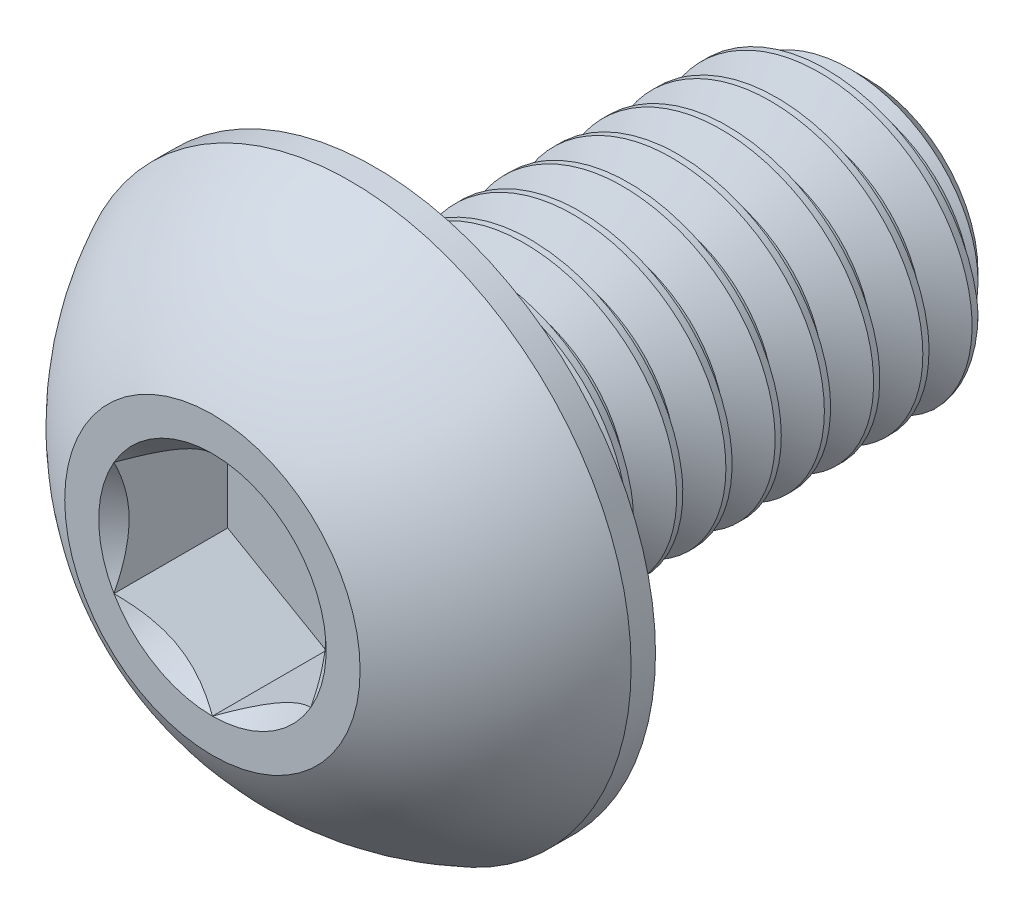
from build123d import *

# Parameters (mm, degrees)
SKETCH1_W          = 5
SKETCH1_H          = 1.5
CHAMFER1_SIZE      = 0.375
CUT_SWEEP1_PITCH   = 0.5
CUT_EXTRUDE2_DEPTH = 1.155


with BuildPart() as part:
    # Sketch1 → Revolve1 (revolve)
    with BuildSketch(Plane(origin=(0, 0, 0), x_dir=(0, 0, -1), z_dir=(1, 0, 0))):
        with Locations((4.15, 0.75)):
            Rectangle(SKETCH1_W, SKETCH1_H)
    revolve(axis=Axis((0, 0, -6.65), (0, 0, 1)))

    # Chamfer1
    chamfer1_edges = [part.edges().sort_by_distance(p)[0] for p in [
        (0, -1.5, -6.65),
    ]]
    chamfer(chamfer1_edges, length=CHAMFER1_SIZE)

    # Cut-Sweep1: the profile of Sketch2 profile screwed along a right-hand helix of 11 turns, 6 arcs to a turn; built about Z, then put on its axis
    cut_sweep1_z = Axis((0, 0, 0), (0, 0, 1))
    cut_sweep1_corners = [(1.5003, 0, 0.000173205), (1.5003, 0, -0.437673205), (1.175240474, 0, -0.25), (1.175240474, 0, -0.1875)]
    with BuildLine(mode=Mode.PRIVATE) as cut_sweep1_profile:
        Line(cut_sweep1_corners[0], cut_sweep1_corners[1])
        Line(cut_sweep1_corners[1], cut_sweep1_corners[2])
        Line(cut_sweep1_corners[2], cut_sweep1_corners[3])
        Line(cut_sweep1_corners[3], cut_sweep1_corners[0])
    cut_sweep1_cap = Face(cut_sweep1_profile.wire())
    cut_sweep1_turn_angles = [0, 30, 60, 90, 120, 150, 180, 210, 240, 270, 300, 330, 360]
    cut_sweep1_turn_weights = [1, 0.8660254037844387, 1, 0.8660254037844387, 1, 0.8660254037844387, 1, 0.8660254037844387, 1, 0.8660254037844387, 1, 0.8660254037844387, 1]
    cut_sweep1_turn_rails = [Edge.make_bspline([Vector(p[0], p[1], 0).rotate(cut_sweep1_z, cut_sweep1_turn_angles[k]) / cut_sweep1_turn_weights[k] + Vector(0, 0, p[2] + CUT_SWEEP1_PITCH * cut_sweep1_turn_angles[k] / 360) for k in range(13)], [0, 0, 0, 1, 1, 2, 2, 3, 3, 4, 4, 5, 5, 6, 6, 6], 2, cut_sweep1_turn_weights) for p in cut_sweep1_corners]
    cut_sweep1_turn_sides = [Face.make_surface_from_curves(cut_sweep1_turn_rails[p[0]], cut_sweep1_turn_rails[p[1]]) for p in [(0, 1), (1, 2), (2, 3), (3, 0)]]
    cut_sweep1 = Plane(origin=(0, 0, -6.65), x_dir=(0, 1, 0), z_dir=(0, 0, 1)) * Solid(Shell([*[p.moved(Location((0, 0, CUT_SWEEP1_PITCH * i))) for i in range(11) for p in cut_sweep1_turn_sides], cut_sweep1_cap, cut_sweep1_cap.rotate(cut_sweep1_z, 3960).moved(Location((0, 0, CUT_SWEEP1_PITCH * 3960 / 360)))]))
    add(cut_sweep1, mode=Mode.SUBTRACT)

    # Sketch7 → Revolve2 (revolve)
    with BuildSketch(Plane(origin=(0, 0, 0), x_dir=(0, 0, -1), z_dir=(1, 0, 0)), mode=Mode.PRIVATE) as revolve2_sk:
        with BuildLine():
            Line((1.4025, 2.85), (1.65, 2.85))
            Line((1.65, 2.85), (1.65, 0))
            Line((1.65, 0), (0, 0))
            Line((0, 0), (0, 1.5))
            ThreePointArc((0, 1.5), (0.59512511, 2.285251969), (1.4025, 2.85))
        make_face()
    revolve(revolve2_sk.sketch.rotate(Axis((0, 0, 0), (0, 0, -1)), 189.336081704), axis=Axis((0, 0, 0), (0, 0, -1)))

    # Sketch5 → Cut-Extrude2 (cut)
    with BuildSketch(Plane.XY):
        Polygon((1, -0.577350269), (1, 0.577350269), (0, 1.154700538), (-1, 0.577350269), (-1, -0.577350269), (0, -1.154700538), align=None)
    extrude(amount=-CUT_EXTRUDE2_DEPTH, mode=Mode.SUBTRACT)

    # Cut-Extrude3 cone 1 section (through the dimple's axis) → Cut-Extrude3 (revolve, cut)
    with BuildSketch(Plane(origin=(0, 0, 0), x_dir=(0, -1, 0), z_dir=(1, 0, 0))):
        Polygon((0, 0), (1.154700538, 0), (0, 1.154700538), align=None)
    revolve(axis=Axis((0, 0, 0), (0, 0, -1)), mode=Mode.SUBTRACT)


solid = part.part
